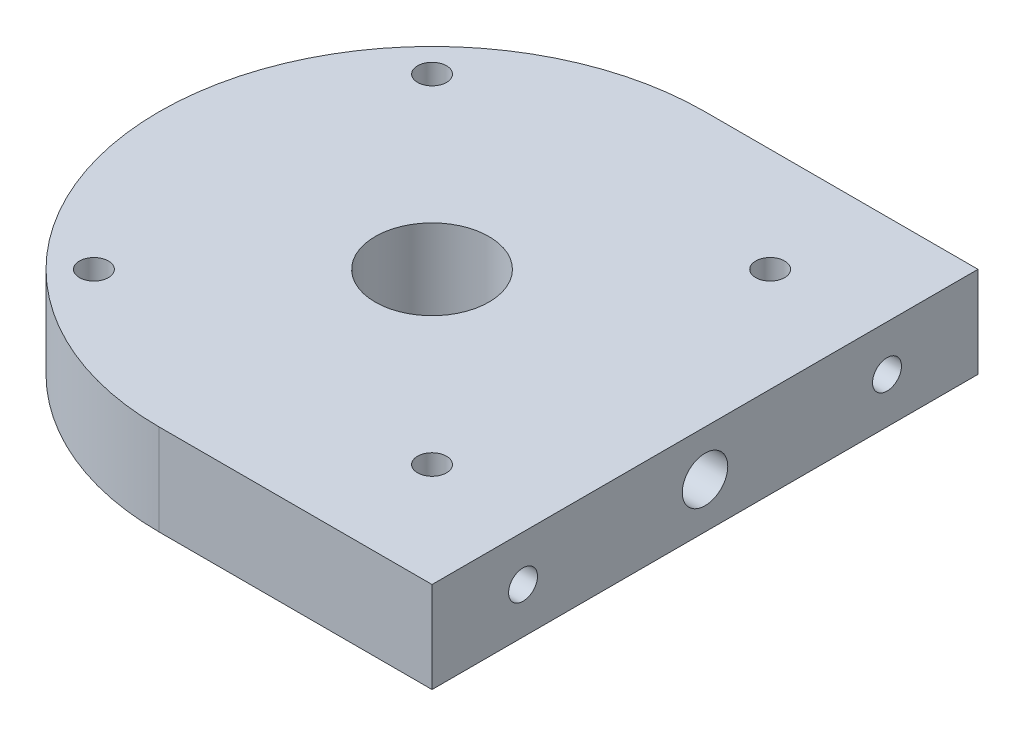
from build123d import *

# Parameters (mm, degrees)
SKETCH1_W                  = 76.2
SKETCH1_H                  = 76.2
BOSS_EXTRUDE1_DEPTH        = 12.7
F_10_32_TAPPED_HOLE1_D     = 4.0386
F_10_32_TAPPED_HOLE1_DEPTH = 9.652
F_10_32_TAPPED_HOLE1_TIP   = 1.213317848
F_10_32_TAPPED_HOLE2_D     = 4.0386
SKETCH9_R                  = 7.9375
CUT_EXTRUDE2_DEPTH         = 56.358016583
FILLET1_R                  = 38.1
SKETCH10_R                 = 3.175
CUT_EXTRUDE3_DEPTH         = 56.358016583


with BuildPart() as part:
    # Sketch1 → Boss-Extrude1 (new body)
    with BuildSketch(Plane(origin=(0, 0, 0), x_dir=(1, 0, 0), z_dir=(0, 1, 0))):
        Rectangle(SKETCH1_W, SKETCH1_H)
    extrude(amount=BOSS_EXTRUDE1_DEPTH)

    # #10-32 Tapped Hole1
    with Locations(Plane(origin=(38.1, 0, 0), x_dir=(0, 0, -1), z_dir=(1, 0, 0))):
        with Locations((-25.4, 6.35), (25.4, 6.35)):
            Hole(F_10_32_TAPPED_HOLE1_D / 2, depth=F_10_32_TAPPED_HOLE1_DEPTH)
            with Locations((0, 0, -(F_10_32_TAPPED_HOLE1_DEPTH + F_10_32_TAPPED_HOLE1_TIP / 2))):  # 118° drill point
                Cone(0, F_10_32_TAPPED_HOLE1_D / 2, F_10_32_TAPPED_HOLE1_TIP, mode=Mode.SUBTRACT)

    # #10-32 Tapped Hole2 (through all)
    with Locations(Plane(origin=(0, 12.7, 0), x_dir=(1, 0, 0), z_dir=(0, 1, 0))):
        with Locations((-23.5966, -23.5966), (-23.5966, 23.5966), (23.5966, 23.5966), (23.5966, -23.5966)):
            Hole(F_10_32_TAPPED_HOLE2_D / 2)

    # Sketch9 → Cut-Extrude2 (cut, through all)
    with BuildSketch(Plane(origin=(0, 12.7, 0), x_dir=(1, 0, 0), z_dir=(0, 1, 0))):
        with Locations(Location((0, 0, 0), (0, 0, 270))):
            Circle(SKETCH9_R)
    extrude(amount=-CUT_EXTRUDE2_DEPTH, mode=Mode.SUBTRACT)

    # Fillet1
    fillet1_edges = [part.edges().sort_by_distance(p)[0] for p in [
        (-38.1, 6.35, -38.1),
        (-38.1, 6.35, 38.1),
    ]]
    fillet(fillet1_edges, radius=FILLET1_R - 0.0001)  # a hair under: the kernel refuses the full size

    # Sketch10 → Cut-Extrude3 (cut, through all)
    with BuildSketch(Plane(origin=(0, 0, 0), x_dir=(0, 0, -1), z_dir=(1, 0, 0))):
        with Locations(Location((0, 6.35, 0), (0, 0, 180))):
            Circle(SKETCH10_R)
    extrude(amount=CUT_EXTRUDE3_DEPTH, mode=Mode.SUBTRACT)


solid = part.part
